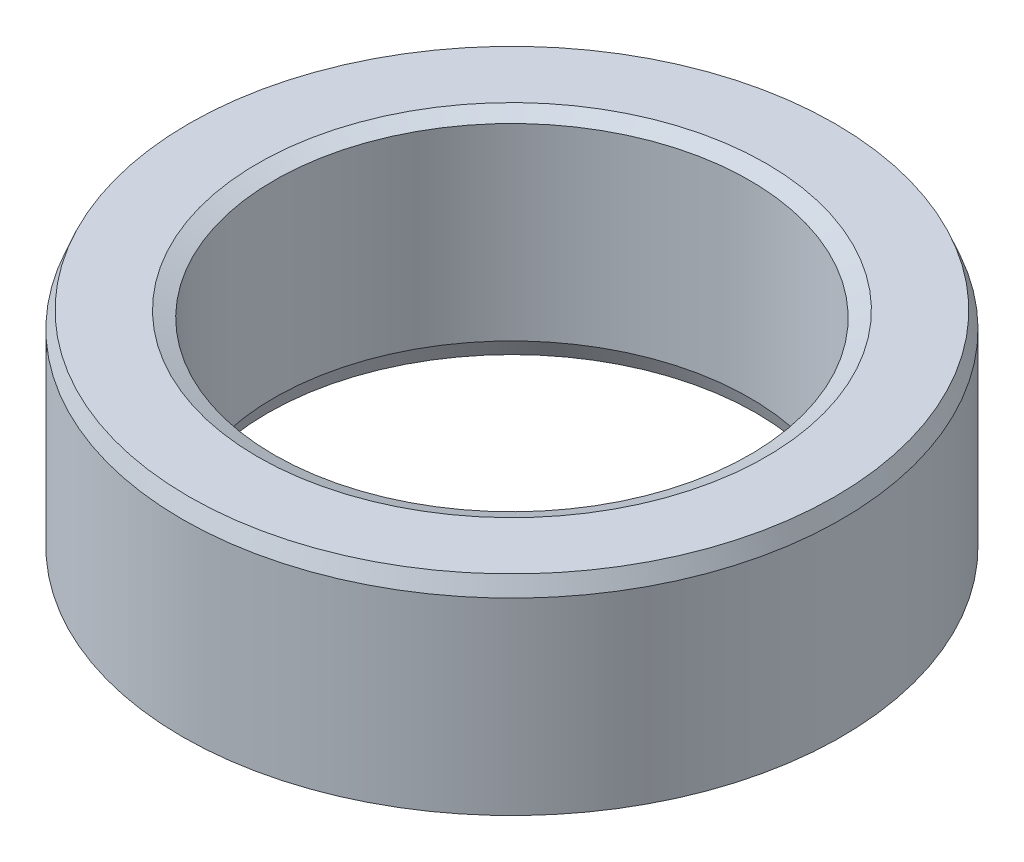
from build123d import *
from OCP.BRepFilletAPI import BRepFilletAPI_MakeChamfer

# Parameters (mm, degrees)
SKETCH1_R           = 57.5
BOSS_EXTRUDE1_DEPTH = 36.852805394
SKETCH2_R           = 41.483702743
CUT_EXTRUDE1_DEPTH  = 90.278380728
CHAMFER1_SIZE       = 2.864563818
CHAMFER1_SIZE2      = 1.135268652


with BuildPart() as part:
    # Sketch1 → Boss-Extrude1 (new body)
    with BuildSketch(Plane(origin=(0, 0, 0), x_dir=(1, 0, 0), z_dir=(0, 1, 0))):
        Circle(SKETCH1_R)
    extrude(amount=BOSS_EXTRUDE1_DEPTH)

    # Sketch2 → Cut-Extrude1 (cut, through all)
    with BuildSketch(Plane(origin=(0, 0, 0), x_dir=(1, 0, 0), z_dir=(0, 1, 0))):
        Circle(SKETCH2_R)
    extrude(amount=CUT_EXTRUDE1_DEPTH, mode=Mode.SUBTRACT)

    # Chamfer1: one chamfer whose edges measure the first distance from different faces: ONE call of the kernel's chamfer builder (chamfer() names one face for all edges)
    chamfer1_edges_1 = [part.edges().sort_by_distance(p)[0] for p in [
        (-41.483702743, 36.852805394, 0),
    ]]
    chamfer1_side_1 = [part.faces().sort_by_distance(p)[0] for p in [
        (-55.873654403, 36.852805394, 0),
    ]]
    chamfer1_edges_2 = [part.edges().sort_by_distance(p)[0] for p in [
        (-41.483702743, 0, 0),
    ]]
    chamfer1_side_2 = [part.faces().sort_by_distance(p)[0] for p in [
        (-41.483702743, 18.426402697, 0),
    ]]
    chamfer1_edges_3 = [part.edges().sort_by_distance(p)[0] for p in [
        (-57.5, 0, 0),
    ]]
    chamfer1_side_3 = [part.faces().sort_by_distance(p)[0] for p in [
        (-55.873654403, 0, 0),
    ]]
    chamfer1_edges_4 = [part.edges().sort_by_distance(p)[0] for p in [
        (-57.5, 36.852805394, 0),
    ]]
    chamfer1_side_4 = [part.faces().sort_by_distance(p)[0] for p in [
        (-57.5, 18.426402697, 0),
    ]]
    chamfer1 = BRepFilletAPI_MakeChamfer(part.part.solid().wrapped)
    for e in chamfer1_edges_1:
        chamfer1.Add(CHAMFER1_SIZE, CHAMFER1_SIZE2, e.wrapped, chamfer1_side_1[0].wrapped)  # the first distance lies on this face
    for e in chamfer1_edges_2:
        chamfer1.Add(CHAMFER1_SIZE, CHAMFER1_SIZE2, e.wrapped, chamfer1_side_2[0].wrapped)  # the first distance lies on this face
    for e in chamfer1_edges_3:
        chamfer1.Add(CHAMFER1_SIZE, CHAMFER1_SIZE2, e.wrapped, chamfer1_side_3[0].wrapped)  # the first distance lies on this face
    for e in chamfer1_edges_4:
        chamfer1.Add(CHAMFER1_SIZE, CHAMFER1_SIZE2, e.wrapped, chamfer1_side_4[0].wrapped)  # the first distance lies on this face
    add(Compound.cast(chamfer1.Shape()), mode=Mode.REPLACE)


solid = part.part
